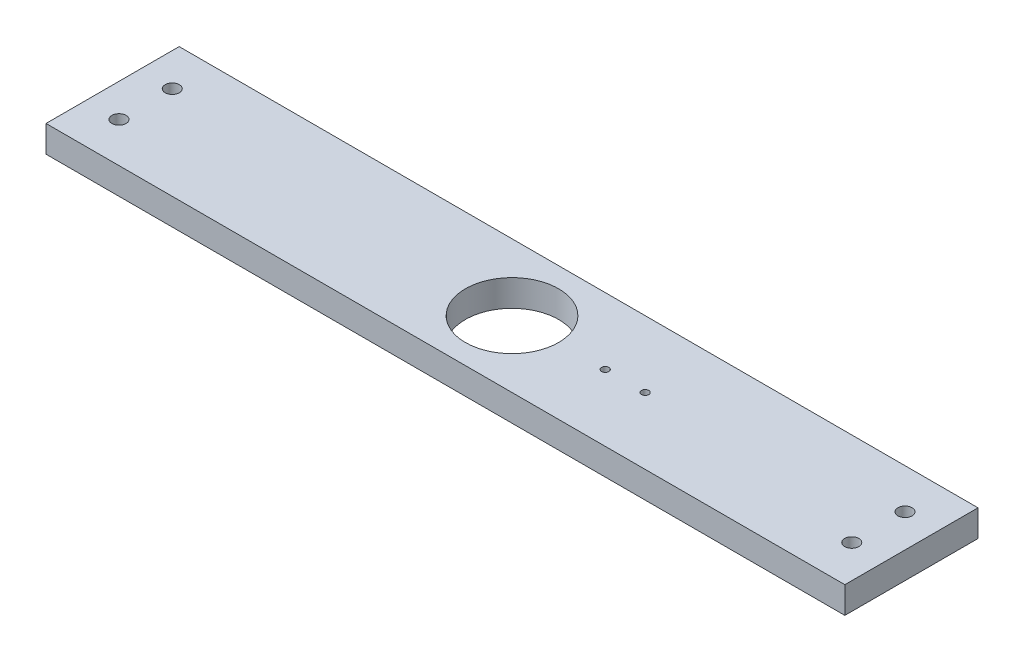
from build123d import *

# Parameters (mm, degrees)
SKETCH1_W               = 381
SKETCH1_H               = 63.5
BOSS_EXTRUDE1_DEPTH     = 12.7
SKETCH2_R               = 22.225
CUT_EXTRUDE1_DEPTH      = 194.544833307
F_1_4_CLEARANCE_HOLE1_D = 6.7564
F_8_32_TAPPED_HOLE1_D   = 3.4544


with BuildPart() as part:
    # Sketch1 → Boss-Extrude1 (new body)
    with BuildSketch(Plane(origin=(0, 0, 0), x_dir=(1, 0, 0), z_dir=(0, 1, 0))):
        Rectangle(SKETCH1_W, SKETCH1_H)
    extrude(amount=BOSS_EXTRUDE1_DEPTH)

    # Sketch2 → Cut-Extrude1 (cut, through all)
    with BuildSketch(Plane(origin=(0, 12.7, 0), x_dir=(1, 0, 0), z_dir=(0, 1, 0))):
        Circle(SKETCH2_R)
    extrude(amount=-CUT_EXTRUDE1_DEPTH, mode=Mode.SUBTRACT)

    # 1/4 Clearance Hole1 (through all)
    with Locations(Plane(origin=(0, 12.7, 0), x_dir=(1, 0, 0), z_dir=(0, 1, 0))):
        with Locations((-174.738781322, 12.7), (174.738781322, 12.7), (-174.738781322, -12.7), (174.738781322, -12.7)):
            Hole(F_1_4_CLEARANCE_HOLE1_D / 2)

    # #8-32 Tapped Hole1 (through all)
    with Locations(Plane(origin=(0, 12.7, 0), x_dir=(1, 0, 0), z_dir=(0, 1, 0))):
        with Locations((63.5, 0), (44.45, 0)):
            Hole(F_8_32_TAPPED_HOLE1_D / 2)


solid = part.part
